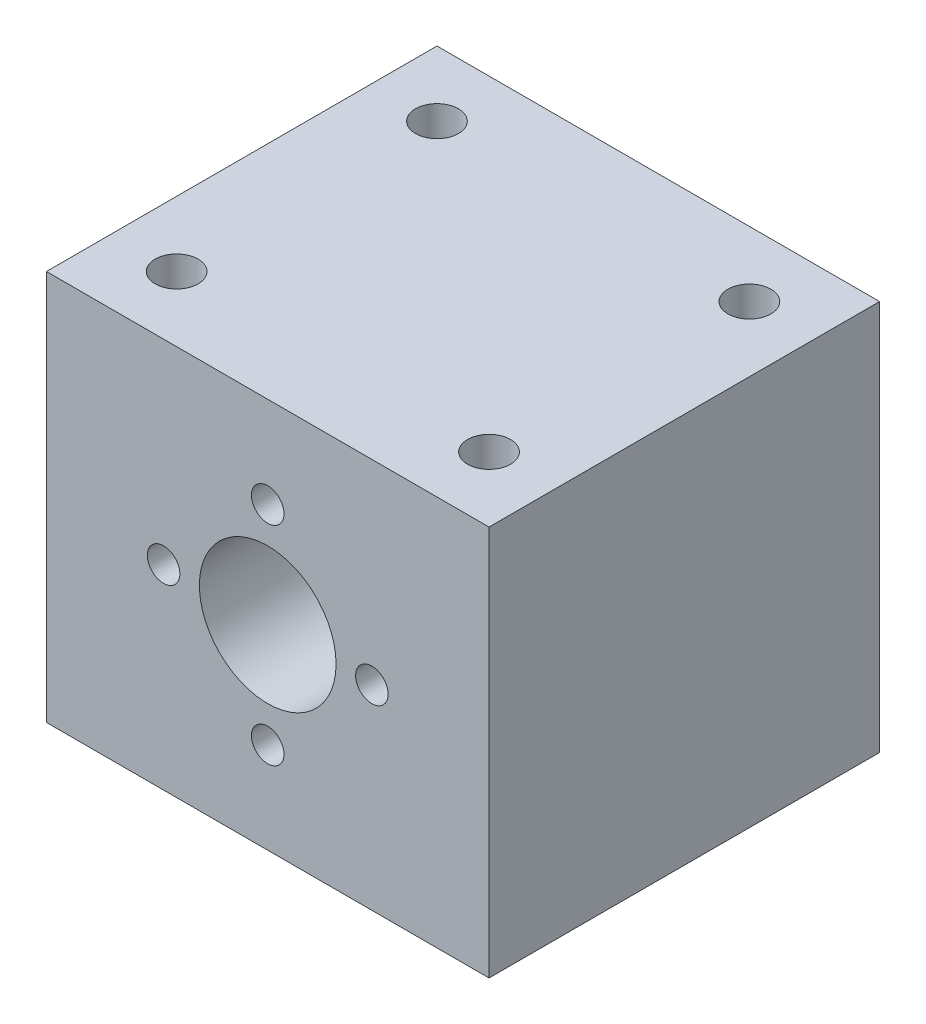
from build123d import *

# Parameters (mm, degrees)
SKETCH_1_W          = 34
SKETCH_1_H          = 30
EXTRUDE_1_DEPTH     = 15
SKETCH_3_R          = 5.25
CUT_EXTRUDE_1_DEPTH = 38.603191354
M3X0_5_1_D          = 2.5
M3X0_5_1_DEPTH      = 10
M3X0_5_1_TIP        = 0.751075774
M4X0_7_1_D          = 3.3
M4X0_7_1_DEPTH      = 20
M4X0_7_1_TIP        = 0.991420021


with BuildPart() as part:
    # 草圖1 → 填料-伸長1 (new, symmetric)
    with BuildSketch(Plane.XY):
        Rectangle(SKETCH_1_W, SKETCH_1_H)
    extrude(amount=EXTRUDE_1_DEPTH, both=True)

    # 草圖3 → 除料-伸長1 (cut, through all)
    with BuildSketch(Plane.XY.offset(15)):
        Circle(SKETCH_3_R)
    extrude(amount=-CUT_EXTRUDE_1_DEPTH, mode=Mode.SUBTRACT)

    # M3x0.5 螺紋孔1
    with Locations(Plane.XY.offset(15)):
        with Locations((8, 0), (-8, 0), (0, 8), (0, -8)):
            Hole(M3X0_5_1_D / 2, depth=M3X0_5_1_DEPTH)
            with Locations((0, 0, -(M3X0_5_1_DEPTH + M3X0_5_1_TIP / 2))):  # 118° drill point
                Cone(0, M3X0_5_1_D / 2, M3X0_5_1_TIP, mode=Mode.SUBTRACT)

    # M4x0.7 螺紋孔1
    with Locations(Plane(origin=(0, 15, 0), x_dir=(1, 0, 0), z_dir=(0, 1, 0))):
        with Locations((12, -10), (-12, 10), (-12, -10), (12, 10)):
            Hole(M4X0_7_1_D / 2, depth=M4X0_7_1_DEPTH)
            with Locations((0, 0, -(M4X0_7_1_DEPTH + M4X0_7_1_TIP / 2))):  # 118° drill point
                Cone(0, M4X0_7_1_D / 2, M4X0_7_1_TIP, mode=Mode.SUBTRACT)


solid = part.part
